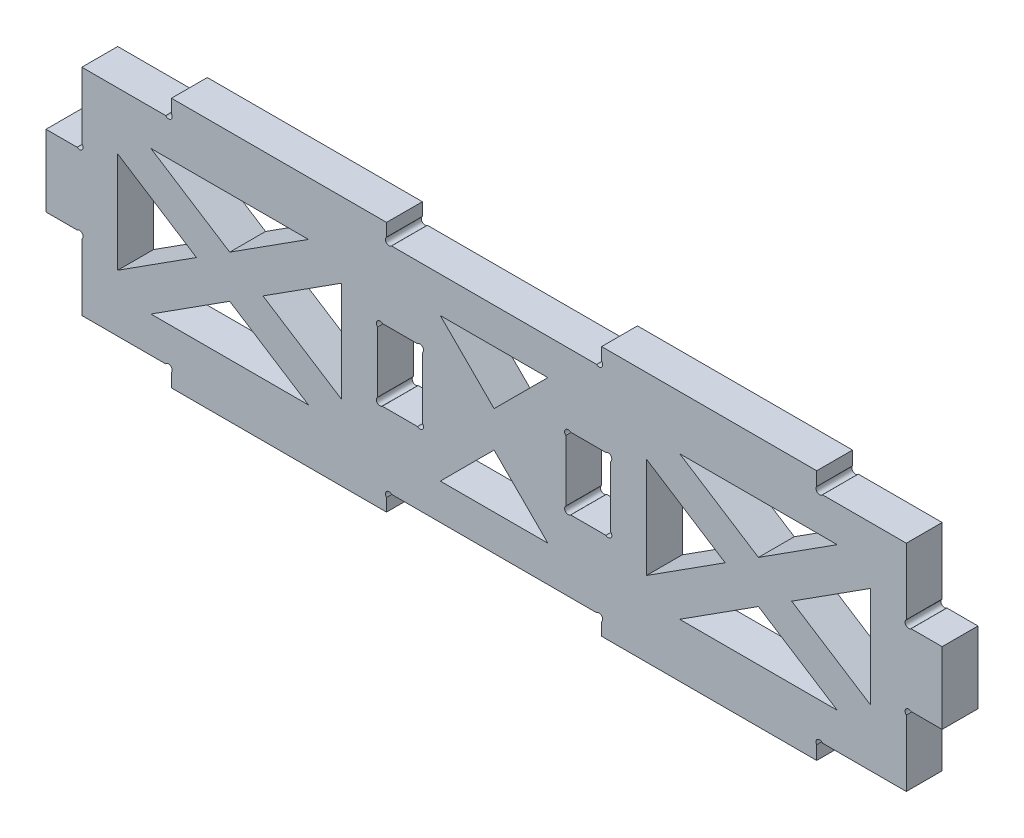
from build123d import *

# Parameters (mm, degrees)
SKETCH1_W           = 317.5
SKETCH1_H           = 76.2
BOSS_EXTRUDE1_DEPTH = 12.7
SKETCH2_W           = 76.2
SKETCH2_H           = 6.35
BOSS_EXTRUDE2_DEPTH = 12.7
SKETCH3_W           = 12.7
SKETCH3_H           = 25.4
SKETCH3_W_2         = 15.875
CUT_EXTRUDE1_DEPTH  = 166.344050392
SKETCH7_R           = 1.27
CUT_EXTRUDE4_DEPTH  = 166.344050392
SKETCH8_R           = 1.27
CUT_EXTRUDE5_DEPTH  = 166.344050392
CUT_EXTRUDE6_DEPTH  = 166.344050392


with BuildPart() as part:
    # Sketch1 → Boss-Extrude1 (new body)
    with BuildSketch(Plane.XY):
        Rectangle(SKETCH1_W, SKETCH1_H)
    extrude(amount=BOSS_EXTRUDE1_DEPTH)

    # Sketch2 → Boss-Extrude2 (add)
    with BuildSketch(Plane.XY.offset(12.7)):
        with Locations((-76.2, -41.275)):
            Rectangle(SKETCH2_W, SKETCH2_H)
        with Locations((76.2, -41.275)):
            Rectangle(SKETCH2_W, SKETCH2_H)
        with Locations((76.2, 41.275)):
            Rectangle(SKETCH2_W, SKETCH2_H)
        with Locations((-76.2, 41.275)):
            Rectangle(SKETCH2_W, SKETCH2_H)
    extrude(amount=-BOSS_EXTRUDE2_DEPTH)

    # Sketch3 → Cut-Extrude1 (cut, through all)
    with BuildSketch(Plane.XY.offset(12.7)):
        with Locations((-152.4, -25.4)):
            Rectangle(SKETCH3_W, SKETCH3_H)
        with Locations((-152.4, 25.4)):
            Rectangle(SKETCH3_W, SKETCH3_H)
        with Locations((152.4, 25.4)):
            Rectangle(SKETCH3_W, SKETCH3_H)
        with Locations((152.4, -25.4)):
            Rectangle(SKETCH3_W, SKETCH3_H)
        with Locations((33.3375, 0)):
            Rectangle(SKETCH3_W_2, SKETCH3_H)
        with Locations((-33.3375, 0)):
            Rectangle(SKETCH3_W_2, SKETCH3_H)
    extrude(amount=-CUT_EXTRUDE1_DEPTH, mode=Mode.SUBTRACT)

    # Sketch7 → Cut-Extrude4 (cut, through all)
    with BuildSketch(Plane.XY.offset(12.7)):
        with Locations((-115.322216931, -38.853639533)):
            Circle(SKETCH7_R)
        with Locations((-37.219883345, -39.015584335)):
            Circle(SKETCH7_R)
        with Locations((37.219883345, -39.015584335)):
            Circle(SKETCH7_R)
        with Locations((115.322216931, -38.853639533)):
            Circle(SKETCH7_R)
        with Locations((115.322216931, 38.853639533)):
            Circle(SKETCH7_R)
        with Locations((37.219883345, 39.015584335)):
            Circle(SKETCH7_R)
        with Locations((-37.219883345, 39.015584335)):
            Circle(SKETCH7_R)
        with Locations((-115.322216931, 38.853639533)):
            Circle(SKETCH7_R)
        with Locations((-146.889550892, -13.652918832)):
            Circle(SKETCH7_R)
        with Locations((-146.889550892, 13.652918832)):
            Circle(SKETCH7_R)
        with Locations((146.889550892, -13.652918832)):
            Circle(SKETCH7_R)
        with Locations((146.889550892, 13.652918832)):
            Circle(SKETCH7_R)
    extrude(amount=-CUT_EXTRUDE4_DEPTH, mode=Mode.SUBTRACT)

    # Sketch8 → Cut-Extrude5 (cut, through all)
    with BuildSketch(Plane.XY.offset(12.7)):
        with Locations((-40.441329163, 11.741932708)):
            Circle(SKETCH8_R)
        with Locations((-26.266083676, 11.771130221)):
            Circle(SKETCH8_R)
        with Locations((-26.266083676, -11.771130221)):
            Circle(SKETCH8_R)
        with Locations((-40.441329163, -11.741932708)):
            Circle(SKETCH8_R)
        with Locations((40.441329163, -11.741932708)):
            Circle(SKETCH8_R)
        with Locations((26.266083676, -11.771130221)):
            Circle(SKETCH8_R)
        with Locations((26.266083676, 11.771130221)):
            Circle(SKETCH8_R)
        with Locations((40.441329163, 11.741932708)):
            Circle(SKETCH8_R)
    extrude(amount=-CUT_EXTRUDE5_DEPTH, mode=Mode.SUBTRACT)

    # Sketch4 → Cut-Extrude6 (cut, through all)
    with BuildSketch(Plane.XY.offset(12.7)):
        Polygon((-93.6625, -7.539137616), (-121.570097474, -25.4), (-65.754902526, -25.4), align=None)
        Polygon((-133.35, 17.860862384), (-133.35, -17.860862384), (-105.442402526, 0), align=None)
        Polygon((-81.882597474, 0), (-53.975, -17.860862384), (-53.975, 17.860862384), align=None)
        Polygon((-65.754902526, 25.4), (-121.570097474, 25.4), (-93.6625, 7.539137616), align=None)
        Polygon((19.05, 25.4), (-19.05, 25.4), (0, 6.35), align=None)
        Polygon((0, -6.35), (-19.05, -25.4), (19.05, -25.4), align=None)
    cut_extrude6 = extrude(amount=-CUT_EXTRUDE6_DEPTH, mode=Mode.SUBTRACT)

    # Mirror1: Cut-Extrude6 across plane
    add(cut_extrude6.mirror(Plane(origin=(0, 0, 0), x_dir=(0, 0, 1), z_dir=(1, 0, 0))), mode=Mode.SUBTRACT)


solid = part.part
